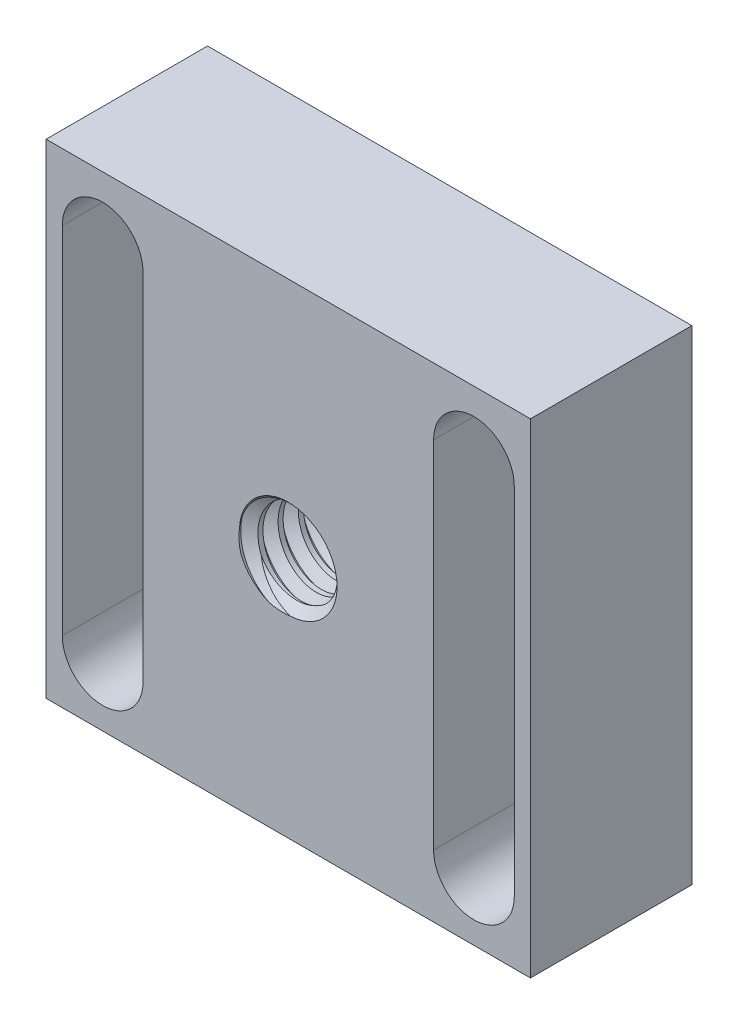
from build123d import *

# Parameters (mm, degrees)
SKETCH_1_W                   = 30
SKETCH_1_H                   = 30
EXTRUDE_1_DEPTH              = 10
CUT_EXTRUDE_1_DEPTH          = 150
SKETCH_9_W                   = 1.5
SKETCH_9_H                   = 2
HOLE_WIZARD_M6_2_D           = 5
HOLE_WIZARD_M6_2_DEPTH       = 10
HOLE_WIZARD_M6_2_CSINK_D     = 6.05
HOLE_WIZARD_M6_2_CSINK_ANGLE = 90
HOLE_WIZARD_M6_2_TIP         = 1.502151548
THREAD_1_PITCH               = 1.25


with BuildPart() as part:
    # Sketch 1 → 凸台-拉伸1 (new body)
    with BuildSketch(Plane.XY):
        Rectangle(SKETCH_1_W, SKETCH_1_H)
    extrude(amount=-EXTRUDE_1_DEPTH)

    # 草图5 → 切除-拉伸1 (cut)
    with BuildSketch(Plane.XY):
        with BuildLine():
            Line((-14, 10.870542248), (-14, -11.129457752))
            ThreePointArc((-14, -11.129457752), (-11.5, -13.629457752), (-9, -11.129457752))
            Line((-9, -11.129457752), (-9, 10.870542248))
            ThreePointArc((-9, 10.870542248), (-11.5, 13.370542248), (-14, 10.870542248))
        make_face()
    cut_extrude_1 = extrude(amount=-CUT_EXTRUDE_1_DEPTH, mode=Mode.SUBTRACT)

    # 镜向1: 切除-拉伸1 across plane
    add(cut_extrude_1.mirror(Plane(origin=(0, 0, 0), x_dir=(0, 0, 1), z_dir=(1, 0, 0))), mode=Mode.SUBTRACT)

    # 草图9 → 切除-旋转1 (revolve, cut)
    with BuildSketch(Plane(origin=(0, 0, 0), x_dir=(1, 0, 0), z_dir=(0, 1, 0))):
        with Locations((7.25, 9)):
            Rectangle(SKETCH_9_W, SKETCH_9_H)
    revolve(axis=Axis((0, 0, 0), (0, 0, -1)), mode=Mode.SUBTRACT)

    # M6 螺纹孔2
    with Locations(Plane.XY):
        with Locations((0, 0)):
            CounterSinkHole(HOLE_WIZARD_M6_2_D / 2, HOLE_WIZARD_M6_2_CSINK_D / 2, depth=HOLE_WIZARD_M6_2_DEPTH, counter_sink_angle=HOLE_WIZARD_M6_2_CSINK_ANGLE)
            with Locations((0, 0, -(HOLE_WIZARD_M6_2_DEPTH + HOLE_WIZARD_M6_2_TIP / 2))):  # 118° drill point
                Cone(0, HOLE_WIZARD_M6_2_D / 2, HOLE_WIZARD_M6_2_TIP, mode=Mode.SUBTRACT)

    # 螺纹线1: the profile of Sketch 1 2 profile screwed along a right-hand helix of 8 turns, 8 arcs to a turn; built about Z, then put on its axis
    thread_1_z = Axis((0, 0, 0), (0, 0, 1))
    thread_1_corners = [(2.4997, 0, -0.000173205), (3.176582344, 0, 0.390624998), (3.176582344, 0, 0.546874998), (2.4997, 0, 0.937673202)]
    with BuildLine(mode=Mode.PRIVATE) as thread_1_profile:
        Line(thread_1_corners[0], thread_1_corners[1])
        Line(thread_1_corners[1], thread_1_corners[2])
        Line(thread_1_corners[2], thread_1_corners[3])
        Line(thread_1_corners[3], thread_1_corners[0])
    thread_1_cap = Face(thread_1_profile.wire())
    thread_1_turn_angles = [0, 22.5, 45, 67.5, 90, 112.5, 135, 157.5, 180, 202.5, 225, 247.5, 270, 292.5, 315, 337.5, 360]
    thread_1_turn_weights = [1, 0.9238795325112867, 1, 0.9238795325112867, 1, 0.9238795325112867, 1, 0.9238795325112867, 1, 0.9238795325112867, 1, 0.9238795325112867, 1, 0.9238795325112867, 1, 0.9238795325112867, 1]
    thread_1_turn_rails = [Edge.make_bspline([Vector(p[0], p[1], 0).rotate(thread_1_z, thread_1_turn_angles[k]) / thread_1_turn_weights[k] + Vector(0, 0, p[2] + THREAD_1_PITCH * thread_1_turn_angles[k] / 360) for k in range(17)], [0, 0, 0, 1, 1, 2, 2, 3, 3, 4, 4, 5, 5, 6, 6, 7, 7, 8, 8, 8], 2, thread_1_turn_weights) for p in thread_1_corners]
    thread_1_turn_sides = [Face.make_surface_from_curves(thread_1_turn_rails[p[0]], thread_1_turn_rails[p[1]]) for p in [(0, 1), (1, 2), (2, 3), (3, 0)]]
    thread_1 = Plane(origin=(0, 0, -10), x_dir=(1, 0, 0), z_dir=(0, 0, 1)) * Solid(Shell([*[p.moved(Location((0, 0, THREAD_1_PITCH * i))) for i in range(8) for p in thread_1_turn_sides], thread_1_cap, thread_1_cap.rotate(thread_1_z, 2880).moved(Location((0, 0, THREAD_1_PITCH * 2880 / 360)))]))
    add(thread_1, mode=Mode.SUBTRACT)


solid = part.part
